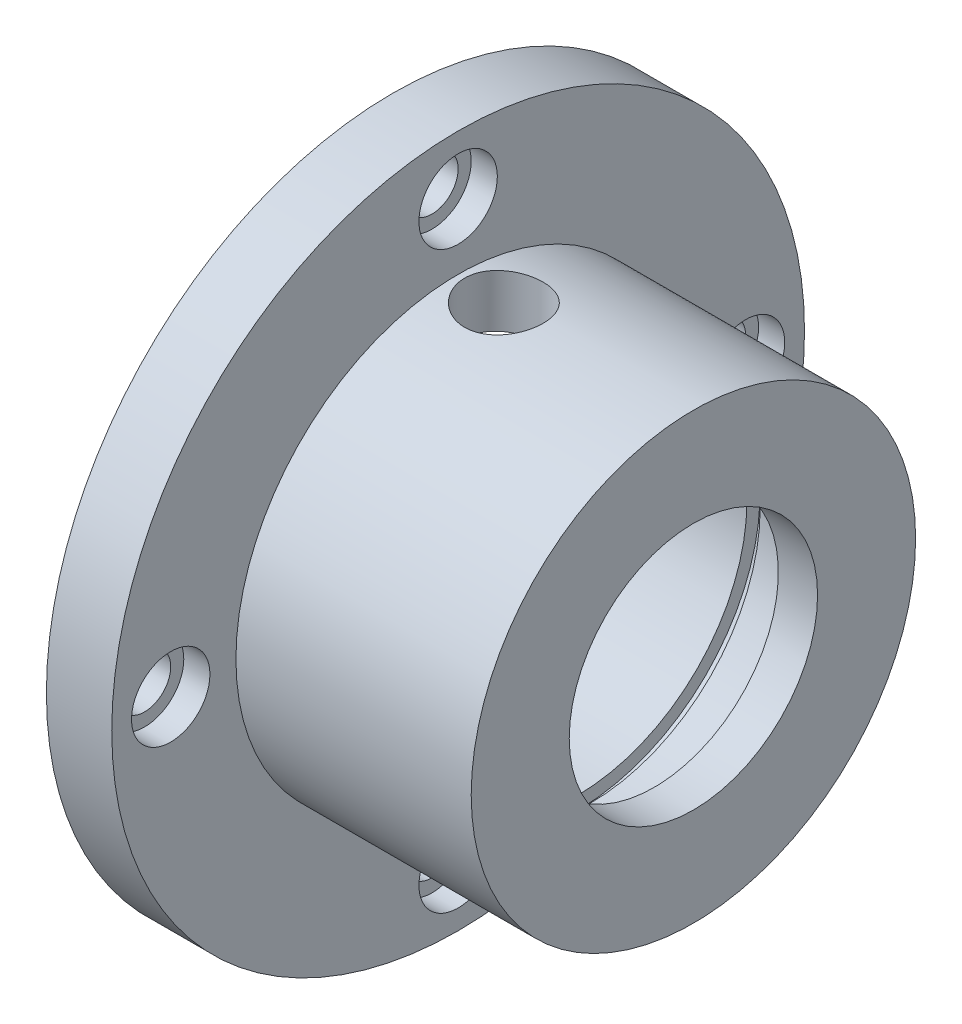
from build123d import *

# Parameters (mm, degrees)
SKETCH1_R           = 26.5
SKETCH1_R_2         = 2
BOSS_EXTRUDE1_DEPTH = 11.5
CUT_EXTRUDE1_START  = -18
SKETCH2_R           = 26.5
SKETCH2_R_2         = 2
SKETCH2_R_3         = 17
CUT_EXTRUDE1_DEPTH  = 18
SKETCH3_R           = 13
CUT_EXTRUDE2_DEPTH  = 20
SKETCH4_R           = 9.5
CUT_EXTRUDE3_DEPTH  = 20
SKETCH5_R           = 14
CUT_EXTRUDE4_DEPTH  = 0.505
SKETCH6_R           = 3
CUT_EXTRUDE5_DEPTH  = 33
SKETCH9_R           = 3
CUT_EXTRUDE7_DEPTH  = 2


with BuildPart() as part:
    # Sketch1 → Boss-Extrude1 (new, symmetric)
    with BuildSketch(Plane(origin=(0, 0, 0), x_dir=(0, 0, -1), z_dir=(1, 0, 0))):
        Circle(SKETCH1_R)
        with Locations((0, -21.987670406)):
            Circle(SKETCH1_R_2, mode=Mode.SUBTRACT)
        with Locations((-21.987670406, 0)):
            Circle(SKETCH1_R_2, mode=Mode.SUBTRACT)
        with Locations((0, 21.987670406)):
            Circle(SKETCH1_R_2, mode=Mode.SUBTRACT)
        with Locations((21.987670406, 0)):
            Circle(SKETCH1_R_2, mode=Mode.SUBTRACT)
    extrude(amount=BOSS_EXTRUDE1_DEPTH, both=True)

    # Sketch2 → Cut-Extrude1 (cut)
    with BuildSketch(Plane(origin=(11.5, 0, 0), x_dir=(0, 0, -1), z_dir=(1, 0, 0)).offset(CUT_EXTRUDE1_START)):
        Circle(SKETCH2_R)
        with Locations((0, -21.987670406)):
            Circle(SKETCH2_R_2, mode=Mode.SUBTRACT)
        with Locations((-21.987670406, 0)):
            Circle(SKETCH2_R_2, mode=Mode.SUBTRACT)
        with Locations((0, 21.987670406)):
            Circle(SKETCH2_R_2, mode=Mode.SUBTRACT)
        Circle(SKETCH2_R_3, mode=Mode.SUBTRACT)
        with Locations((21.987670406, 0)):
            Circle(SKETCH2_R_2, mode=Mode.SUBTRACT)
    extrude(amount=CUT_EXTRUDE1_DEPTH, mode=Mode.SUBTRACT)

    # Sketch3 → Cut-Extrude2 (cut)
    with BuildSketch(Plane.ZY.offset(11.5)):
        Circle(SKETCH3_R)
    extrude(amount=-CUT_EXTRUDE2_DEPTH, mode=Mode.SUBTRACT)

    # Sketch4 → Cut-Extrude3 (cut)
    with BuildSketch(Plane.ZY.offset(-8.5)):
        Circle(SKETCH4_R)
    extrude(amount=-CUT_EXTRUDE3_DEPTH, mode=Mode.SUBTRACT)

    # Sketch5 → Cut-Extrude4 (cut, symmetric)
    with BuildSketch(Plane.ZY.offset(-3.1)):
        Circle(SKETCH5_R)
    extrude(amount=CUT_EXTRUDE4_DEPTH, both=True, mode=Mode.SUBTRACT)

    # Sketch6 → Cut-Extrude5 (cut)
    with BuildSketch(Plane(origin=(0, 0, 0), x_dir=(1, 0, 0), z_dir=(0, 1, 0))):
        with Locations((-3, 0)):
            Circle(SKETCH6_R)
    extrude(amount=CUT_EXTRUDE5_DEPTH, mode=Mode.SUBTRACT)

    # Sketch9 → Cut-Extrude7 (cut)
    with BuildSketch(Plane(origin=(-6.5, 0, 0), x_dir=(0, 0, -1), z_dir=(1, 0, 0))):
        with Locations((0, 21.987670406)):
            Circle(SKETCH9_R)
        with Locations((21.987670406, 0)):
            Circle(SKETCH9_R)
        with Locations((0, -21.987670406)):
            Circle(SKETCH9_R)
        with Locations((-21.987670406, 0)):
            Circle(SKETCH9_R)
    extrude(amount=-CUT_EXTRUDE7_DEPTH, mode=Mode.SUBTRACT)


solid = part.part
